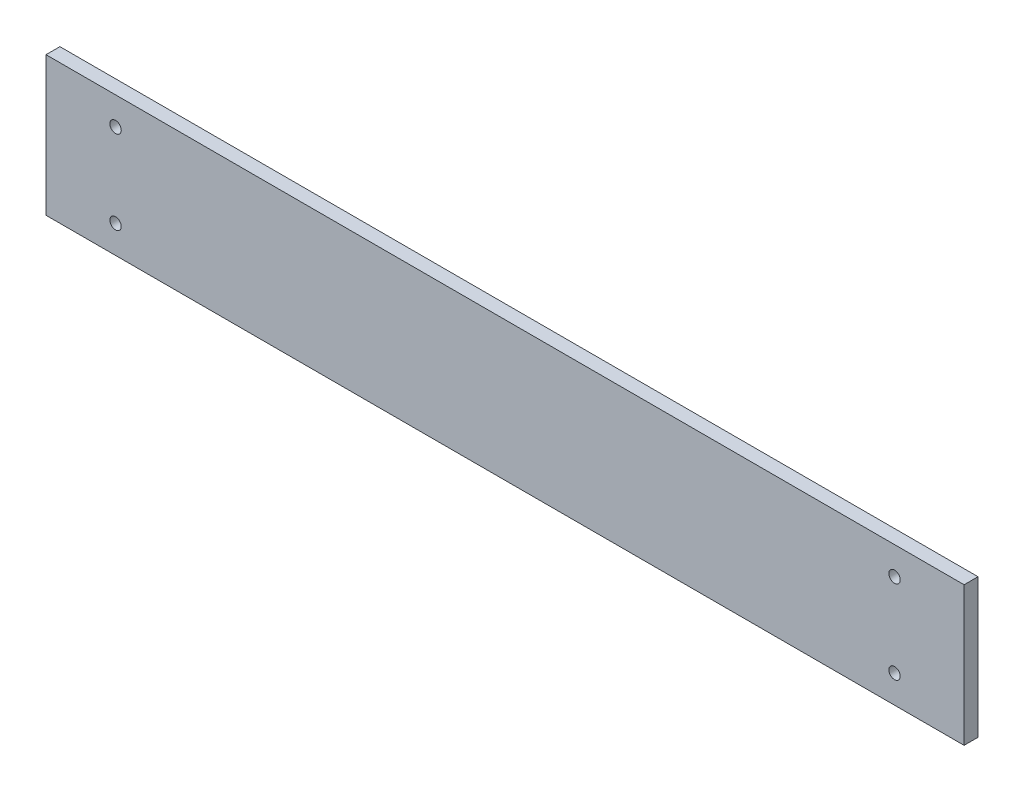
from build123d import *

# Parameters (mm, degrees)
ESQUISSE2_W        = 330
ESQUISSE2_H        = 50
ESQUISSE2_R        = 2.05
BOSS_EXTRU_1_DEPTH = 5


with BuildPart() as part:
    # Esquisse2 → Boss.-Extru.1 (new body)
    with BuildSketch(Plane.XY):
        Rectangle(ESQUISSE2_W, ESQUISSE2_H)
        with Locations((-140, 15)):
            Circle(ESQUISSE2_R, mode=Mode.SUBTRACT)
        with Locations((140, 15)):
            Circle(ESQUISSE2_R, mode=Mode.SUBTRACT)
        with Locations((-140, -15)):
            Circle(ESQUISSE2_R, mode=Mode.SUBTRACT)
        with Locations((140, -15)):
            Circle(ESQUISSE2_R, mode=Mode.SUBTRACT)
    extrude(amount=BOSS_EXTRU_1_DEPTH)


solid = part.part
